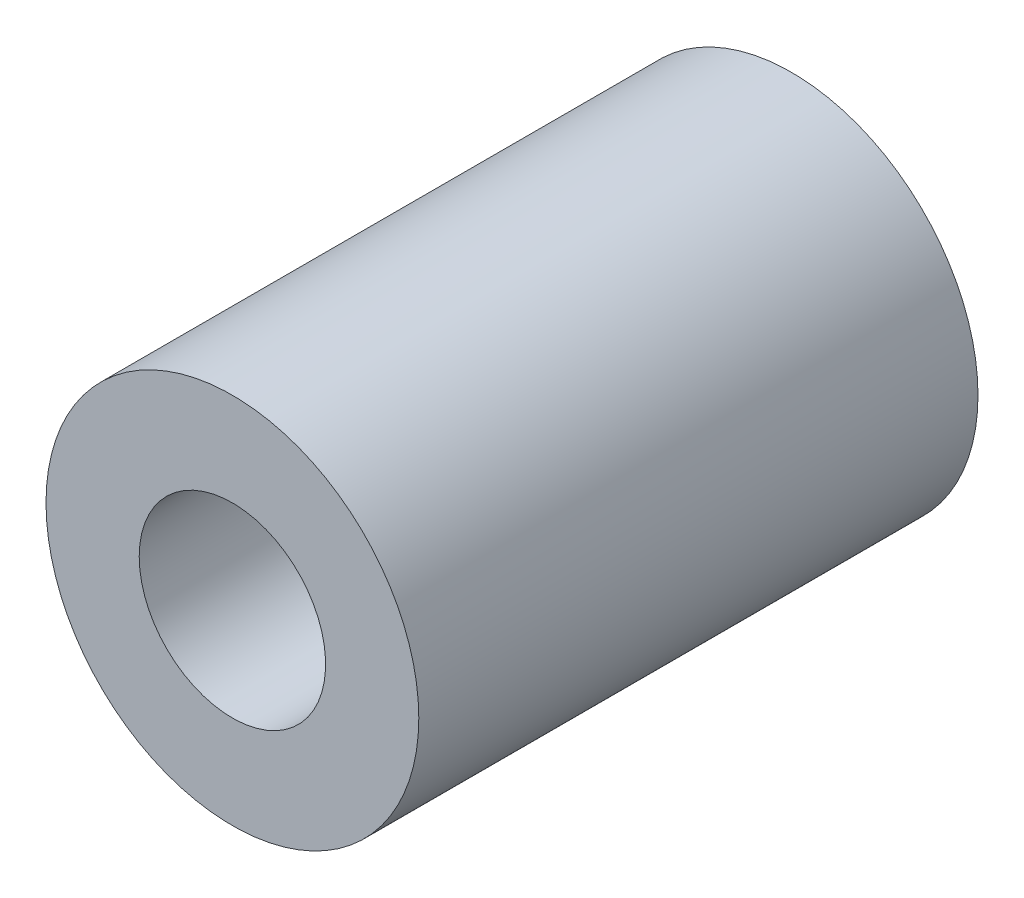
from build123d import *

# Parameters (mm, degrees)
SKETCH1_R           = 3.175
SKETCH1_R_2         = 1.5875
BOSS_EXTRUDE1_DEPTH = 9.525
SCALE1_SCALE        = 0.75


with BuildPart() as part:
    # Sketch1 → Boss-Extrude1 (new body)
    with BuildSketch(Plane.XY):
        Circle(SKETCH1_R)
        Circle(SKETCH1_R_2, mode=Mode.SUBTRACT)
    extrude(amount=BOSS_EXTRUDE1_DEPTH)


with BuildPart() as part_1:
    # Scale1: scaled about (0, 0, 4.7625)
    add(part.part.scale(SCALE1_SCALE).moved(Location((0, 0, 1.190625))))


solid = part_1.part
